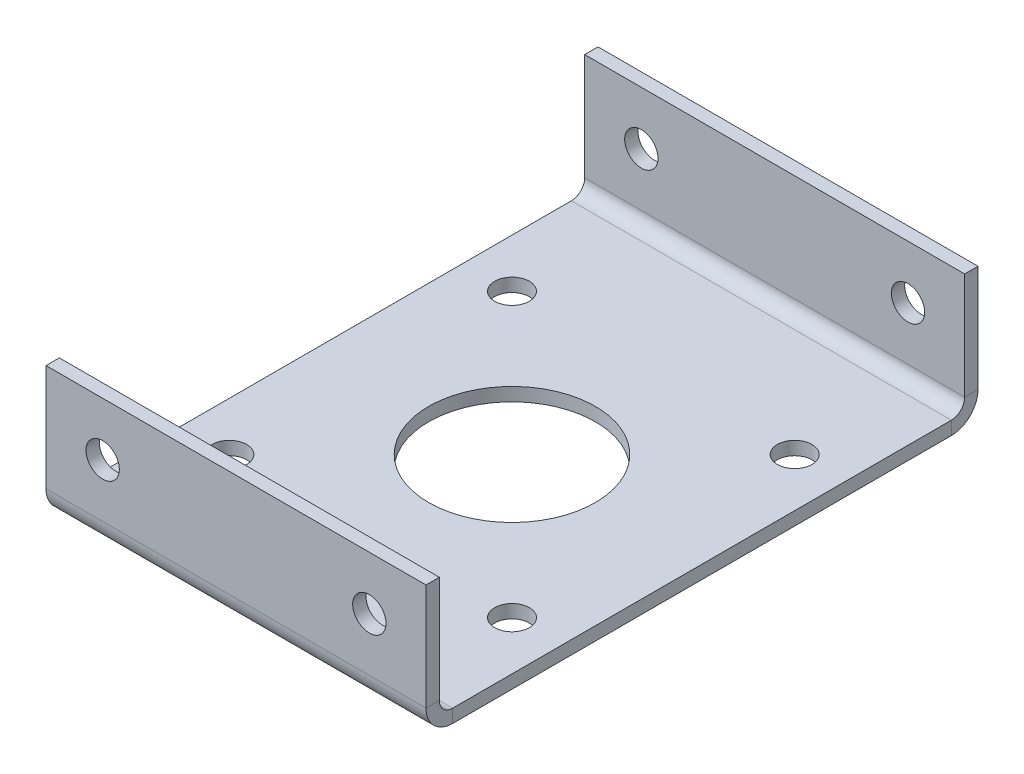
from build123d import *

# Parameters (mm, degrees)
SKETCH1_W                    = 36.195
SKETCH1_H                    = 50.038
SKETCH1_R                    = 7.9375
BASE_FLANGE1_DEPTH           = 1.27
EDGE_FLANGE1_STRIP_W         = 7.62
EDGE_FLANGE1_STRIP_H         = 1.27
EDGE_FLANGE1_STRIP_CUT_DEPTH = 36.195
EDGE_FLANGE1_DEPTH           = 36.195
SKETCH9_R                    = 1.651
CUT_EXTRUDE1_DEPTH           = 34.900972364
CUT_EXTRUDE2_DEPTH           = 57.768041099
CUT_EXTRUDE2_DEPTH_BACK      = 57.768041099
SKETCH10_R                   = 1.5875
CIRPATTERN2_COUNT            = 4


# Sheet-metal steps are written as plain solids
with BuildPart() as part:
    # Sketch1 → Base-Flange1 (new body)
    with BuildSketch(Plane(origin=(0, 0, 0), x_dir=(1, 0, 0), z_dir=(0, 1, 0))):
        Rectangle(SKETCH1_W, SKETCH1_H)
        with Locations(Location((0, 0, 0), (0, 0, 270))):
            Circle(SKETCH1_R, mode=Mode.SUBTRACT)
    extrude(amount=-BASE_FLANGE1_DEPTH)

    # Edge-Flange1 strip (across the edge) → Edge-Flange1 strip cut (cut)
    with BuildSketch(Plane(origin=(-18.0975, 0, 25.019), x_dir=(0, 0, -1), z_dir=(1, 0, 0))):
        with Locations((-2.54, -0.635)):
            Rectangle(EDGE_FLANGE1_STRIP_W, EDGE_FLANGE1_STRIP_H)
    edge_flange1_strip_cut = extrude(amount=EDGE_FLANGE1_STRIP_CUT_DEPTH, mode=Mode.SUBTRACT)

    # Edge-Flange1 section (across the edge) → Edge-Flange1 (add)
    with BuildSketch(Plane(origin=(-18.0975, 0, 25.019), x_dir=(0, 0, -1), z_dir=(1, 0, 0))):
        with BuildLine():
            Line((-1.27, 1.27), (-1.27, 11.43))
            Line((-1.27, 11.43), (0, 11.43))
            Line((0, 11.43), (0, 1.27))
            ThreePointArc((0, 1.27), (0.371974388, 0.371974388), (1.27, 0))
            Line((1.27, 0), (1.27, -1.27))
            ThreePointArc((1.27, -1.27), (-0.526051224, -0.526051224), (-1.27, 1.27))
        make_face()
    edge_flange1 = extrude(amount=EDGE_FLANGE1_DEPTH)

    # Mirror1: Edge-Flange1 strip cut, Edge-Flange1 across plane
    add(edge_flange1_strip_cut.mirror(Plane.XY), mode=Mode.SUBTRACT)
    add(edge_flange1.mirror(Plane.XY))

    # Sketch9 → Cut-Extrude1 (cut, through all)
    with BuildSketch(Plane(origin=(0, 0, 0), x_dir=(1, 0, 0), z_dir=(0, 1, 0))):
        with Locations(Location((13.462, 13.462, 0), (0, 0, 270))):
            Circle(SKETCH9_R)
    cut_extrude1 = extrude(amount=-CUT_EXTRUDE1_DEPTH, mode=Mode.SUBTRACT)

    # Sketch10 → Cut-Extrude2 (cut, two sides: drawn at the far end of the back side and taken through both)
    with BuildSketch(Plane(origin=(0, 0, -26.289), x_dir=(-1, 0, 0), z_dir=(0, 0, -1)).offset(-CUT_EXTRUDE2_DEPTH_BACK)):
        with Locations((-12.7, 6.35)):
            Circle(SKETCH10_R)
        with Locations((12.7, 6.35)):
            Circle(SKETCH10_R)
    extrude(amount=CUT_EXTRUDE2_DEPTH + CUT_EXTRUDE2_DEPTH_BACK, mode=Mode.SUBTRACT)

    # CirPattern2: Cut-Extrude1 ×4 about axis
    cirpattern2_axis = Axis((0, 0, 0), (0, 1, 0))
    for i in range(1, CIRPATTERN2_COUNT):
        add(cut_extrude1.rotate(cirpattern2_axis, i * 360 / CIRPATTERN2_COUNT), mode=Mode.SUBTRACT)


solid = part.part
